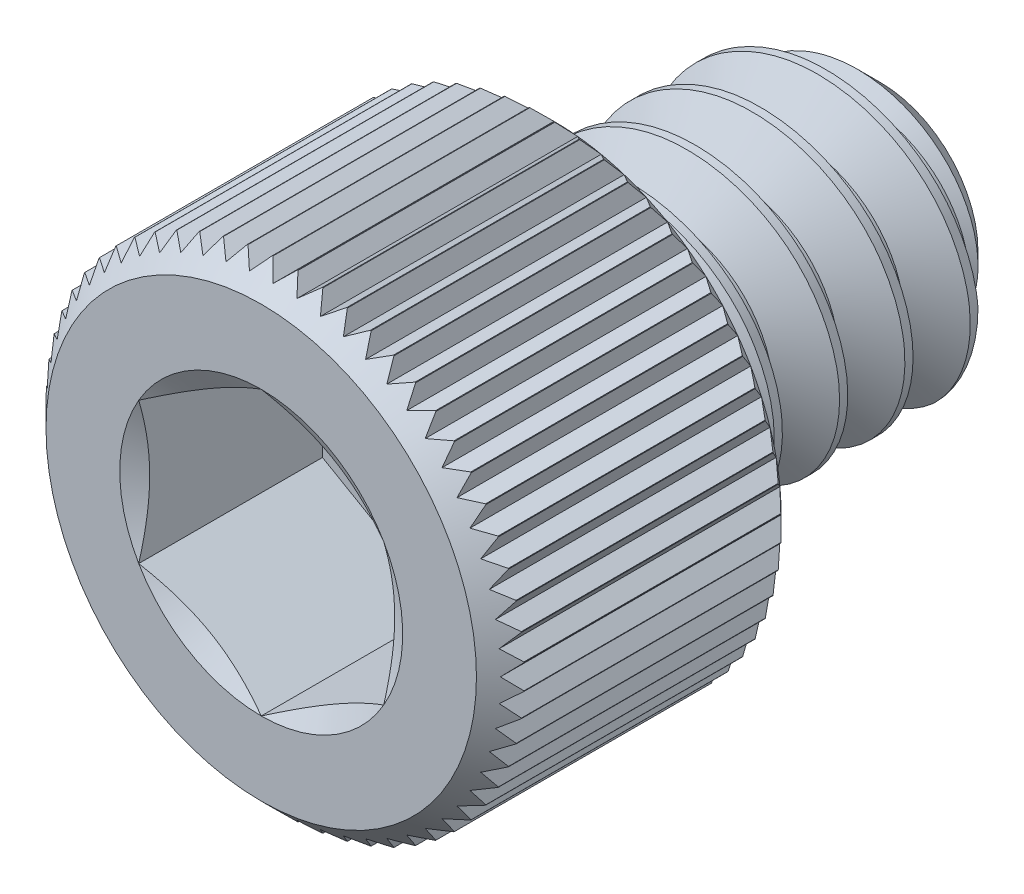
from build123d import *
from build123d.topology import SkipClean

# Parameters (mm, degrees)
CUT_EXTRUDE1_DEPTH = 1.7859375
CHAMFER1_SIZE      = 0.23241
CHAMFER2_SIZE      = 0.116205
CUT_SWEEP1_PITCH   = 0.635
CUT_SWEEP1_TO      = 3.175
CUT_EXTRUDE3_REACH = 6.57
CIRPATTERN1_COUNT  = 60


with BuildPart() as part:
    # Sketch2 → Revolve1 (revolve)
    with BuildSketch(Plane(origin=(0, 0, 0), x_dir=(0, 0, -1), z_dir=(1, 0, 0)), mode=Mode.PRIVATE) as revolve1_sk:
        Polygon((3.0099, 0.94615), (2.53365, 1.4224), (-0.1651, 1.4224), (-0.1651, 2.3241), (-3.0099, 2.3241), (-3.0099, 0), (3.0099, 0), align=None)
    revolve(revolve1_sk.sketch.rotate(Axis((0, 0, -3.0099), (0, 0, 1)), 90), axis=Axis((0, 0, -3.0099), (0, 0, 1)))

    # Sketch4 → Cut-Extrude1 (cut)
    with BuildSketch(Plane.XY.offset(3.0099)):
        Polygon((0, 1.374815329), (-1.190625, 0.687407664), (-1.190625, -0.687407664), (0, -1.374815329), (1.190625, -0.687407664), (1.190625, 0.687407664), align=None)
    extrude(amount=-CUT_EXTRUDE1_DEPTH, mode=Mode.SUBTRACT)

    # Cut-Extrude2 cone 1 section (through the dimple's axis) → Cut-Extrude2 (revolve, cut)
    with BuildSketch(Plane(origin=(0, 0, 3.0099), x_dir=(0, -1, 0), z_dir=(1, 0, 0))):
        Polygon((0, 0), (1.374815329, 0), (0, 0.79375), align=None)
    revolve(axis=Axis((0, 0, 3.0099), (0, 0, -1)), mode=Mode.SUBTRACT)

    # Chamfer1
    chamfer1_edges = [part.edges().sort_by_distance(p)[0] for p in [
        (2.3241, 0, 3.0099),
    ]]
    chamfer(chamfer1_edges, length=CHAMFER1_SIZE)

    # Chamfer2
    chamfer2_edges = [part.edges().sort_by_distance(p)[0] for p in [
        (2.3241, 0, 0.1651),
    ]]
    chamfer(chamfer2_edges, length=CHAMFER2_SIZE)


with BuildPart() as body_2:
    # Split1: read off the stored shape, not the designer's step
    # Split1: the piece on the far side of the plane
    add(part.part)
    split(bisect_by=Plane.XY.offset(0.1651), keep=Keep.BOTTOM)

    # Cut-Sweep1: arcs per turn and ends read off the stored shape
    # Cut-Sweep1: the profile of Sketch7 profile screwed along a right-hand helix through 6 turns, 6 arcs to a turn; built about Z, then put on its axis
    cut_sweep1_z = Axis((0, 0, 0), (0, 0, 1))
    cut_sweep1_corners = [(1.4227, 0, 0.000173205), (1.4227, 0, -0.555798205), (1.009955401, 0, -0.3175), (1.009955401, 0, -0.238125)]
    with BuildLine(mode=Mode.PRIVATE) as cut_sweep1_profile:
        Line(cut_sweep1_corners[0], cut_sweep1_corners[1])
        Line(cut_sweep1_corners[1], cut_sweep1_corners[2])
        Line(cut_sweep1_corners[2], cut_sweep1_corners[3])
        Line(cut_sweep1_corners[3], cut_sweep1_corners[0])
    cut_sweep1_cap = Face(cut_sweep1_profile.wire())
    cut_sweep1_turn_angles = [0, 30, 60, 90, 120, 150, 180, 210, 240, 270, 300, 330, 360]
    cut_sweep1_turn_weights = [1, 0.8660254037844387, 1, 0.8660254037844387, 1, 0.8660254037844387, 1, 0.8660254037844387, 1, 0.8660254037844387, 1, 0.8660254037844387, 1]
    cut_sweep1_turn_rails = [Edge.make_bspline([Vector(p[0], p[1], 0).rotate(cut_sweep1_z, cut_sweep1_turn_angles[k]) / cut_sweep1_turn_weights[k] + Vector(0, 0, p[2] + CUT_SWEEP1_PITCH * cut_sweep1_turn_angles[k] / 360) for k in range(13)], [0, 0, 0, 1, 1, 2, 2, 3, 3, 4, 4, 5, 5, 6, 6, 6], 2, cut_sweep1_turn_weights) for p in cut_sweep1_corners]
    cut_sweep1_turn_sides = [Face.make_surface_from_curves(cut_sweep1_turn_rails[p[0]], cut_sweep1_turn_rails[p[1]]) for p in [(0, 1), (1, 2), (2, 3), (3, 0)]]
    cut_sweep1 = Plane(origin=(0, 0, -3.0099), x_dir=(0, 1, 0), z_dir=(0, 0, 1)) * split(Solid(Shell([*[p.moved(Location((0, 0, CUT_SWEEP1_PITCH * i))) for i in range(6) for p in cut_sweep1_turn_sides], cut_sweep1_cap, cut_sweep1_cap.rotate(cut_sweep1_z, 2160).moved(Location((0, 0, CUT_SWEEP1_PITCH * 2160 / 360)))])), bisect_by=Plane.XY.offset(CUT_SWEEP1_TO), keep=Keep.BOTTOM, mode=Mode.PRIVATE)
    add(cut_sweep1, mode=Mode.SUBTRACT)


with BuildPart() as part_1:
    add(part.part)

    # Split1
    split(bisect_by=Plane.XY.offset(0.1651), keep=Keep.TOP)

    add(body_2.part)  # Boss-Extrude4 merges body 2
    # Boss-Extrude4 cone 1 section (through the dimple's axis) → Boss-Extrude4 (revolve)
    with BuildSketch(Plane(origin=(0, 0, 0.1651), x_dir=(0, -1, 0), z_dir=(1, 0, 0))):
        Polygon((0, 0), (1.491140766, 0), (0, 1.491140766), align=None)
    revolve(axis=Axis((0, 0, 0.1651), (0, 0, -1)))

    # Cut-Extrude3: up to this cone (the profile starts inside it)
    with SkipClean():  # the faces are left unmerged after this step: merging them gives an invalid solid
        cut_extrude3_end = Plane(origin=(0, 0, 0.1651), z_dir=(0, 0, -1)).offset(-4.936489) * Cone(1e-06, 16.94298, 16.942979, align=(Align.CENTER, Align.CENTER, Align.MIN), mode=Mode.PRIVATE)
        # Sketch9 → Cut-Extrude3 (cut, up to the surface)
        with BuildSketch(Plane(origin=(0, 0, 0.1651), x_dir=(-1, 0, 0), z_dir=(0, 0, -1)), mode=Mode.PRIVATE) as cut_extrude3_sk1:
            Polygon((0, 2.207895), (-0.24360184, 2.440305), (0.24360184, 2.440305), align=None)
        cut_extrude3_tool1 = extrude(cut_extrude3_sk1.sketch, amount=-CUT_EXTRUDE3_REACH, mode=Mode.PRIVATE) & cut_extrude3_end
        cut_extrude3 = cut_extrude3_tool1.solids().sort_by_distance((0, 2.362835, 0.1651))[0]
        add(cut_extrude3, mode=Mode.SUBTRACT)

    # CirPattern1: Cut-Extrude3 ×60 about axis
    cirpattern1_axis = Axis((0, 0, 0), (0, 0, 1))
    for i in range(1, CIRPATTERN1_COUNT):
        add(cut_extrude3.rotate(cirpattern1_axis, i * 360 / CIRPATTERN1_COUNT), mode=Mode.SUBTRACT)


solid = part_1.part
